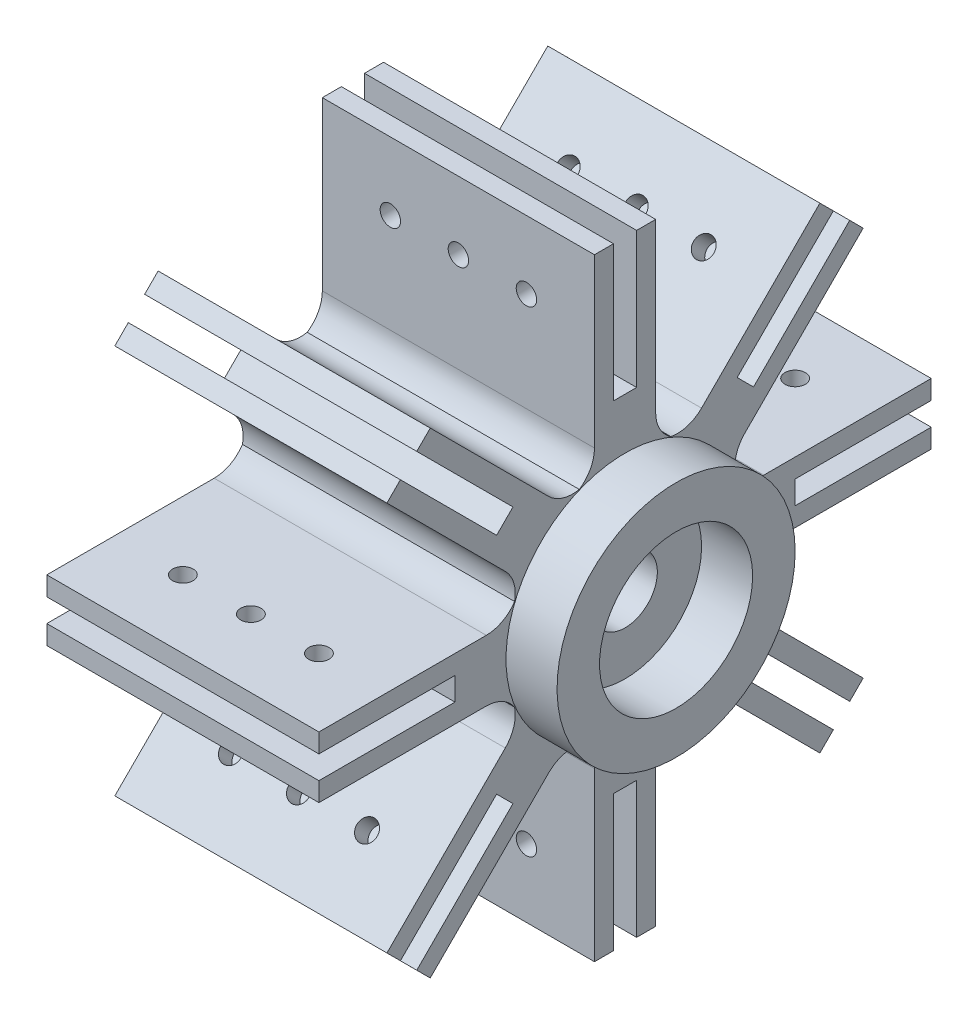
from build123d import *

# Parameters (mm, degrees)
SKETCH1_R               = 17.5
SKETCH1_R_2             = 4.75
MAINBODY_DEPTH          = 40
SKETCH2_R               = 17.5
SKETCH2_R_2             = 11.25
BEARINGHOUSING_DEPTH    = 7.5
SKETCH3_R               = 1.5
MOUNTINGHOLES_DEPTH     = 20
BOSS_EXTRUDE3_DEPTH     = 40
SKETCH6_R               = 1.5
CUT_EXTRUDE2_DEPTH      = 10
FILLET1_R               = 5
CIRPATTERN1_DEPTH       = 40
CIRPATTERN1_START       = -5
CIRPATTERN1_2_OUTLINE_R = 1.5
CIRPATTERN1_2_DEPTH     = 10
CIRPATTERN1_3_OUTLINE_R = 1.5
CIRPATTERN1_3_DEPTH     = 10
CIRPATTERN1_4_OUTLINE_R = 1.5
CIRPATTERN1_4_DEPTH     = 10
CIRPATTERN1_5_OUTLINE_R = 1.5
CIRPATTERN1_5_DEPTH     = 10


with BuildPart() as part:
    # Sketch1 → MainBody (new body)
    with BuildSketch(Plane(origin=(0, 0, 0), x_dir=(0, 0, -1), z_dir=(1, 0, 0))):
        Circle(SKETCH1_R)
        Circle(SKETCH1_R_2, mode=Mode.SUBTRACT)
    extrude(amount=MAINBODY_DEPTH)

    # Sketch2 → BearingHousing (add)
    with BuildSketch(Plane(origin=(40, 0, 0), x_dir=(0, 0, -1), z_dir=(1, 0, 0))):
        Circle(SKETCH2_R)
        Circle(SKETCH2_R_2, mode=Mode.SUBTRACT)
    extrude(amount=BEARINGHOUSING_DEPTH)

    # Sketch3 → MountingHoles (cut)
    with BuildSketch(Plane.ZY):
        with Locations((0, 13)):
            Circle(SKETCH3_R)
        with Locations((11.258330249, 6.5)):
            Circle(SKETCH3_R)
        with Locations((11.258330249, -6.5)):
            Circle(SKETCH3_R)
        with Locations((0, -13)):
            Circle(SKETCH3_R)
        with Locations((-11.258330249, -6.5)):
            Circle(SKETCH3_R)
        with Locations((-11.258330249, 6.5)):
            Circle(SKETCH3_R)
    extrude(amount=-MOUNTINGHOLES_DEPTH, mode=Mode.SUBTRACT)

    # Sketch4 → Boss-Extrude3 (add)
    with BuildSketch(Plane.ZY):
        with BuildLine():
            Line((-4.5, 16.911534525), (-4.5, 45))
            Line((-4.5, 45), (-1.7, 45))
            Line((-1.7, 45), (-1.7, 25))
            Line((-1.7, 25), (1.7, 25))
            Line((1.7, 25), (1.7, 45))
            Line((1.7, 45), (4.5, 45))
            Line((4.5, 45), (4.5, 16.911534525))
            ThreePointArc((4.5, 16.911534525), (0, 17.5), (-4.5, 16.911534525))
        make_face()
    extrude(amount=-BOSS_EXTRUDE3_DEPTH)

    # Sketch6 → Cut-Extrude2 (cut)
    with BuildSketch(Plane(origin=(0, 0, -4.5), x_dir=(-1, 0, 0), z_dir=(0, 0, -1))):
        with Locations((-30, 35)):
            Circle(SKETCH6_R)
        with Locations((-20, 35)):
            Circle(SKETCH6_R)
        with Locations((-10, 35)):
            Circle(SKETCH6_R)
    extrude(amount=-CUT_EXTRUDE2_DEPTH, mode=Mode.SUBTRACT)

    # Fillet1
    fillet1_edges = [part.edges().sort_by_distance(p)[0] for p in [
        (20, 16.911534525, 4.5),
        (20, 16.911534525, -4.5),
    ]]
    fillet(fillet1_edges, radius=FILLET1_R)

    # CirPattern1: read off the stored shape, not the designer's step
    # CirPattern1 outline → CirPattern1 (add)
    with BuildSketch(Plane.YZ):
        with BuildLine():
            Line((-45, 4.5), (-45, 1.7))
            Line((-45, 1.7), (-25, 1.7))
            Line((-25, 1.7), (-25, -1.7))
            Line((-25, -1.7), (-45, -1.7))
            Line((-45, -1.7), (-45, -4.5))
            Line((-45, -4.5), (-20.396078054, -4.5))
            ThreePointArc((-20.396078054, -4.5), (-18.037369477, -5.091316086), (-16.236557831, -6.72540246))
            ThreePointArc((-16.236557831, -6.72540246), (-16.354450402, -9.154242143), (-17.604185617, -11.240224587))
            Line((-17.604185617, -11.240224587), (-35.001785669, -28.637824638))
            Line((-35.001785669, -28.637824638), (-33.021886681, -30.617723625))
            Line((-33.021886681, -30.617723625), (-18.879751058, -16.475588002))
            Line((-18.879751058, -16.475588002), (-16.475588002, -18.879751058))
            Line((-16.475588002, -18.879751058), (-30.617723625, -33.021886681))
            Line((-30.617723625, -33.021886681), (-28.637824638, -35.001785669))
            Line((-28.637824638, -35.001785669), (-11.240224587, -17.604185617))
            ThreePointArc((-11.240224587, -17.604185617), (-9.154242143, -16.354450402), (-6.72540246, -16.236557831))
            ThreePointArc((-6.72540246, -16.236557831), (-5.091316086, -18.037369477), (-4.5, -20.396078054))
            Line((-4.5, -20.396078054), (-4.5, -45))
            Line((-4.5, -45), (-1.7, -45))
            Line((-1.7, -45), (-1.7, -25))
            Line((-1.7, -25), (1.7, -25))
            Line((1.7, -25), (1.7, -45))
            Line((1.7, -45), (4.5, -45))
            Line((4.5, -45), (4.5, -20.396078054))
            ThreePointArc((4.5, -20.396078054), (5.091316086, -18.037369477), (6.72540246, -16.236557831))
            ThreePointArc((6.72540246, -16.236557831), (9.154242143, -16.354450402), (11.240224587, -17.604185617))
            Line((11.240224587, -17.604185617), (28.637824638, -35.001785669))
            Line((28.637824638, -35.001785669), (30.617723625, -33.021886681))
            Line((30.617723625, -33.021886681), (16.475588002, -18.879751058))
            Line((16.475588002, -18.879751058), (18.879751058, -16.475588002))
            Line((18.879751058, -16.475588002), (33.021886681, -30.617723625))
            Line((33.021886681, -30.617723625), (35.001785669, -28.637824638))
            Line((35.001785669, -28.637824638), (17.604185617, -11.240224587))
            ThreePointArc((17.604185617, -11.240224587), (16.354450402, -9.154242143), (16.236557831, -6.72540246))
            ThreePointArc((16.236557831, -6.72540246), (16.037443935, -7.05003906), (15.863616265, -7.388888889))
            ThreePointArc((15.863616265, -7.388888889), (-17.5, 0), (15.863616265, 7.388888889))
            ThreePointArc((15.863616265, 7.388888889), (16.037443935, 7.05003906), (16.236557831, 6.72540246))
            ThreePointArc((16.236557831, 6.72540246), (16.354450402, 9.154242143), (17.604185617, 11.240224587))
            Line((17.604185617, 11.240224587), (35.001785669, 28.637824638))
            Line((35.001785669, 28.637824638), (33.021886681, 30.617723625))
            Line((33.021886681, 30.617723625), (18.879751058, 16.475588002))
            Line((18.879751058, 16.475588002), (16.475588002, 18.879751058))
            Line((16.475588002, 18.879751058), (30.617723625, 33.021886681))
            Line((30.617723625, 33.021886681), (28.637824638, 35.001785669))
            Line((28.637824638, 35.001785669), (11.240224587, 17.604185617))
            ThreePointArc((11.240224587, 17.604185617), (9.154242143, 16.354450402), (6.72540246, 16.236557831))
            ThreePointArc((6.72540246, 16.236557831), (5.091316086, 18.037369477), (4.5, 20.396078054))
            Line((4.5, 20.396078054), (4.5, 45))
            Line((4.5, 45), (1.7, 45))
            Line((1.7, 45), (1.7, 25))
            Line((1.7, 25), (-1.7, 25))
            Line((-1.7, 25), (-1.7, 45))
            Line((-1.7, 45), (-4.5, 45))
            Line((-4.5, 45), (-4.5, 20.396078054))
            ThreePointArc((-4.5, 20.396078054), (-5.091316086, 18.037369477), (-6.72540246, 16.236557831))
            ThreePointArc((-6.72540246, 16.236557831), (-9.154242143, 16.354450402), (-11.240224587, 17.604185617))
            Line((-11.240224587, 17.604185617), (-28.637824638, 35.001785669))
            Line((-28.637824638, 35.001785669), (-30.617723625, 33.021886681))
            Line((-30.617723625, 33.021886681), (-16.475588002, 18.879751058))
            Line((-16.475588002, 18.879751058), (-18.879751058, 16.475588002))
            Line((-18.879751058, 16.475588002), (-33.021886681, 30.617723625))
            Line((-33.021886681, 30.617723625), (-35.001785669, 28.637824638))
            Line((-35.001785669, 28.637824638), (-17.604185617, 11.240224587))
            ThreePointArc((-17.604185617, 11.240224587), (-16.354450402, 9.154242143), (-16.236557831, 6.72540246))
            ThreePointArc((-16.236557831, 6.72540246), (-18.037369477, 5.091316086), (-20.396078054, 4.5))
            Line((-20.396078054, 4.5), (-45, 4.5))
        make_face()
    extrude(amount=CIRPATTERN1_DEPTH)

    # CirPattern1 2 outline → CirPattern1 2 (cut)
    with BuildSketch(Plane(origin=(0, 0, 0), x_dir=(1, 0, 0), z_dir=(0, 0.707106781186539, 0.707106781186556)).offset(CIRPATTERN1_START)):
        with Locations((30, 35)):
            Circle(CIRPATTERN1_2_OUTLINE_R)
        with Locations((20, 35)):
            Circle(CIRPATTERN1_2_OUTLINE_R)
        with Locations((10, 35)):
            Circle(CIRPATTERN1_2_OUTLINE_R)
        with Locations((10, -35)):
            Circle(CIRPATTERN1_2_OUTLINE_R)
        with Locations((20, -35)):
            Circle(CIRPATTERN1_2_OUTLINE_R)
        with Locations((30, -35)):
            Circle(CIRPATTERN1_2_OUTLINE_R)
    extrude(amount=CIRPATTERN1_2_DEPTH, mode=Mode.SUBTRACT)

    # CirPattern1 3 outline → CirPattern1 3 (cut)
    with BuildSketch(Plane(origin=(0, 0, 0), x_dir=(1, 0, 0), z_dir=(0, 1, 0)).offset(CIRPATTERN1_START)):
        with Locations((10, 35)):
            Circle(CIRPATTERN1_3_OUTLINE_R)
        with Locations((30, 35)):
            Circle(CIRPATTERN1_3_OUTLINE_R)
        with Locations((20, 35)):
            Circle(CIRPATTERN1_3_OUTLINE_R)
        with Locations((30, -35)):
            Circle(CIRPATTERN1_3_OUTLINE_R)
        with Locations((20, -35)):
            Circle(CIRPATTERN1_3_OUTLINE_R)
        with Locations((10, -35)):
            Circle(CIRPATTERN1_3_OUTLINE_R)
    extrude(amount=CIRPATTERN1_3_DEPTH, mode=Mode.SUBTRACT)

    # CirPattern1 4 outline → CirPattern1 4 (cut)
    with BuildSketch(Plane(origin=(0, 0, 0), x_dir=(1, 0, 0), z_dir=(0, 0.707106781186554, -0.707106781186541)).offset(CIRPATTERN1_START)):
        with Locations((30, 35)):
            Circle(CIRPATTERN1_4_OUTLINE_R)
        with Locations((20, 35)):
            Circle(CIRPATTERN1_4_OUTLINE_R)
        with Locations((10, 35)):
            Circle(CIRPATTERN1_4_OUTLINE_R)
        with Locations((30, -35)):
            Circle(CIRPATTERN1_4_OUTLINE_R)
        with Locations((20, -35)):
            Circle(CIRPATTERN1_4_OUTLINE_R)
        with Locations((10, -35)):
            Circle(CIRPATTERN1_4_OUTLINE_R)
    extrude(amount=CIRPATTERN1_4_DEPTH, mode=Mode.SUBTRACT)

    # CirPattern1 5 outline → CirPattern1 5 (cut)
    with BuildSketch(Plane.XY.offset(CIRPATTERN1_START)):
        with Locations((10, -35)):
            Circle(CIRPATTERN1_5_OUTLINE_R)
        with Locations((20, -35)):
            Circle(CIRPATTERN1_5_OUTLINE_R)
        with Locations((30, -35)):
            Circle(CIRPATTERN1_5_OUTLINE_R)
    extrude(amount=CIRPATTERN1_5_DEPTH, mode=Mode.SUBTRACT)


solid = part.part
